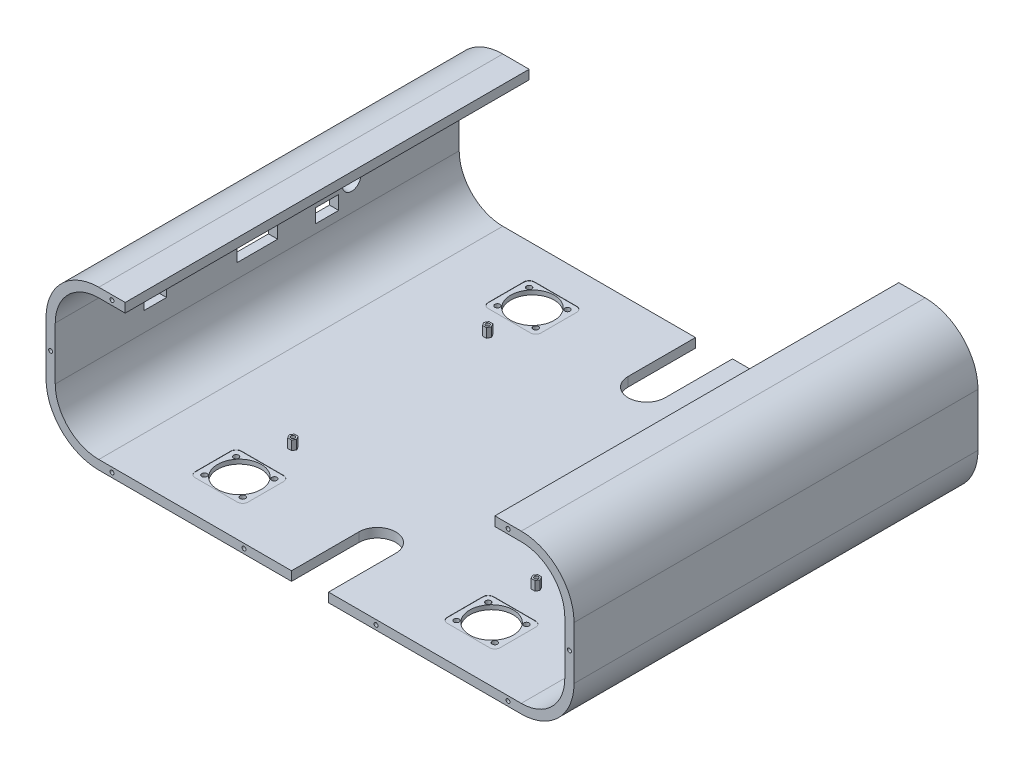
from build123d import *

# Parameters (mm, degrees)
SKETCH1_W               = 400
SKETCH1_H               = 306
BOSS_EXTRUDE1_DEPTH     = 7
BOSS_EXTRUDE3_DEPTH     = 306
CUT_EXTRUDE1_DEPTH      = 385.754467161
CUT_EXTRUDE1_DEPTH_BACK = 385.754467161
CUT_EXTRUDE2_START      = -7
SKETCH7_R               = 1.5
CUT_EXTRUDE2_DEPTH      = 392.754467161
CUT_EXTRUDE3_DEPTH      = 277.003623165
CUT_EXTRUDE3_DEPTH_BACK = 277.003623165
SKETCH8_W               = 28
SKETCH8_H               = 130
FILLET1_R               = 14
FILLET2_R               = 14
BOSS_EXTRUDE4_START     = 2
SKETCH9_R               = 1.5
BOSS_EXTRUDE4_DEPTH     = 7
BOSS_EXTRUDE4_2_DEPTH   = 7
BOSS_EXTRUDE4_3_DEPTH   = 7
BOSS_EXTRUDE4_4_DEPTH   = 7
CUT_EXTRUDE4_DEPTH      = 279.942646435
CUT_EXTRUDE4_DEPTH_BACK = 279.942646435
SKETCH10_R              = 2
SKETCH10_R_2            = 16.5
CUT_EXTRUDE5_DEPTH      = 279.942646435
CUT_EXTRUDE5_DEPTH_BACK = 3.5
SKETCH12_R              = 30
SKETCH13_W              = 40
SKETCH13_H              = 35
CUT_EXTRUDE6_DEPTH      = 0.2
FILLET3_R               = 4
SKETCH16_R              = 6.93
SKETCH16_W              = 31
SKETCH16_H              = 20
SKETCH16_W_2            = 12.2
SKETCH16_H_2            = 5.5
SKETCH16_W_3            = 17.5
SKETCH16_H_3            = 10.5
SKETCH16_W_4            = 17.3
SKETCH16_H_4            = 11.6
CUT_EXTRUDE7_DEPTH      = 10


with BuildPart() as part:
    # Sketch1 → Boss-Extrude1 (new body)
    with BuildSketch(Plane(origin=(0, 0, 0), x_dir=(1, 0, 0), z_dir=(0, 1, 0))):
        Rectangle(SKETCH1_W, SKETCH1_H)
    extrude(amount=BOSS_EXTRUDE1_DEPTH)

    # Sketch5 → Boss-Extrude3 (add)
    with BuildSketch(Plane.XY.offset(153)):
        with BuildLine():
            ThreePointArc((-200, 40), (-195.385112438, 21.348088093), (-182.605309111, 7))
            Line((-182.605309111, 7), (-160, 7))
            ThreePointArc((-160, 7), (-183.334523779, 16.665476221), (-193, 40))
            Line((-193, 40), (-193, 80))
            ThreePointArc((-193, 80), (-183.334523779, 103.334523779), (-160, 113))
            Line((-160, 113), (-140, 113))
            Line((-140, 113), (-140, 120))
            Line((-140, 120), (-160, 120))
            ThreePointArc((-160, 120), (-188.284271247, 108.284271247), (-200, 80))
            Line((-200, 80), (-200, 40))
        make_face()
        with BuildLine():
            ThreePointArc((193, 40), (183.334523779, 16.665476221), (160, 7))
            Line((160, 7), (182.605309111, 7))
            ThreePointArc((182.605309111, 7), (195.385112438, 21.348088093), (200, 40))
            Line((200, 40), (200, 80))
            ThreePointArc((200, 80), (188.284271247, 108.284271247), (160, 120))
            Line((160, 120), (140, 120))
            Line((140, 120), (140, 113))
            Line((140, 113), (160, 113))
            ThreePointArc((160, 113), (183.334523779, 103.334523779), (193, 80))
            Line((193, 80), (193, 40))
        make_face()
    extrude(amount=-BOSS_EXTRUDE3_DEPTH)

    # Sketch6 → Cut-Extrude1 (cut, two sides: drawn at the far end of the back side and taken through both)
    with BuildSketch(Plane.XY.offset(153).offset(-CUT_EXTRUDE1_DEPTH_BACK)):
        with BuildLine():
            Line((-182.605309111, 7), (-200, 7))
            Line((-200, 7), (-200, 0))
            Line((-200, 0), (-160, 0))
            ThreePointArc((-160, 0), (-171.832159566, 1.790053651), (-182.605309111, 7))
        make_face()
        with BuildLine():
            Line((200, 0), (160, 0))
            ThreePointArc((160, 0), (171.832159566, 1.790053651), (182.605309111, 7))
            Line((182.605309111, 7), (200, 7))
            Line((200, 7), (200, 0))
        make_face()
    extrude(amount=CUT_EXTRUDE1_DEPTH + CUT_EXTRUDE1_DEPTH_BACK, mode=Mode.SUBTRACT)

    # Sketch7 → Cut-Extrude2 (cut)
    with BuildSketch(Plane.XY.offset(153).offset(CUT_EXTRUDE2_START)):
        with Locations(Location((-50, 3.5, 0), (0, 0, 180))):
            Circle(SKETCH7_R)
        with Locations(Location((-150, 3.5, 0), (0, 0, 180))):
            Circle(SKETCH7_R)
        with Locations(Location((-196.5, 60, 0), (0, 0, 180))):
            Circle(SKETCH7_R)
        with Locations(Location((-150, 116.5, 0), (0, 0, 180))):
            Circle(SKETCH7_R)
        with Locations(Location((150, 116.5, 0), (0, 0, 180))):
            Circle(SKETCH7_R)
        with Locations(Location((196.5, 60, 0), (0, 0, 180))):
            Circle(SKETCH7_R)
        with Locations(Location((150, 3.5, 0), (0, 0, 180))):
            Circle(SKETCH7_R)
        with Locations(Location((50, 3.5, 0), (0, 0, 180))):
            Circle(SKETCH7_R)
    cut_extrude2 = extrude(amount=CUT_EXTRUDE2_DEPTH, mode=Mode.SUBTRACT)

    # Mirror1: Cut-Extrude2 across plane
    add(cut_extrude2.mirror(Plane.XY), mode=Mode.SUBTRACT)

    # Sketch8 → Cut-Extrude3 (cut, two sides: drawn at the far end of the back side and taken through both)
    with BuildSketch(Plane(origin=(0, 7, 0), x_dir=(1, 0, 0), z_dir=(0, 1, 0)).offset(-CUT_EXTRUDE3_DEPTH_BACK)):
        with Locations((0, -153)):
            Rectangle(SKETCH8_W, SKETCH8_H)
        with Locations((0, 153)):
            Rectangle(SKETCH8_W, SKETCH8_H)
    extrude(amount=CUT_EXTRUDE3_DEPTH + CUT_EXTRUDE3_DEPTH_BACK, mode=Mode.SUBTRACT)

    # Fillet1
    fillet1_edges = [part.edges().sort_by_distance(p)[0] for p in [
        (-14, 3.5, 88),
        (14, 3.5, 88),
    ]]
    fillet(fillet1_edges, radius=FILLET1_R - 0.0001)  # a hair under: the kernel refuses the full size

    # Fillet2
    fillet2_edges = [part.edges().sort_by_distance(p)[0] for p in [
        (14, 3.5, -88),
        (-14, 3.5, -88),
    ]]
    fillet(fillet2_edges, radius=FILLET2_R - 0.0001)  # a hair under: the kernel refuses the full size

    # Sketch10 → Cut-Extrude4 (cut, two sides: drawn at the far end of the back side and taken through both)
    with BuildSketch(Plane.XZ.offset(-CUT_EXTRUDE4_DEPTH_BACK)):
        with Locations(Location((-110, 123, 0), (0, 0, 270))):
            Circle(SKETCH10_R)
        with Locations(Location((-81, 123, 0), (0, 0, 270))):
            Circle(SKETCH10_R)
        with Locations(Location((-110, 99, 0), (0, 0, 270))):
            Circle(SKETCH10_R)
        with Locations(Location((-81, 99, 0), (0, 0, 270))):
            Circle(SKETCH10_R)
        with Locations(Location((-81, -99, 0), (0, 0, 270))):
            Circle(SKETCH10_R)
        with Locations(Location((-110, -99, 0), (0, 0, 270))):
            Circle(SKETCH10_R)
        with Locations(Location((-81, -123, 0), (0, 0, 270))):
            Circle(SKETCH10_R)
        with Locations(Location((-110, -123, 0), (0, 0, 270))):
            Circle(SKETCH10_R)
        with Locations(Location((110, -123, 0), (0, 0, 270))):
            Circle(SKETCH10_R)
        with Locations(Location((81, -123, 0), (0, 0, 270))):
            Circle(SKETCH10_R)
        with Locations(Location((110, -99, 0), (0, 0, 270))):
            Circle(SKETCH10_R)
        with Locations(Location((81, -99, 0), (0, 0, 270))):
            Circle(SKETCH10_R)
        with Locations(Location((81, 99, 0), (0, 0, 270))):
            Circle(SKETCH10_R)
        with Locations(Location((110, 99, 0), (0, 0, 270))):
            Circle(SKETCH10_R)
        with Locations(Location((81, 123, 0), (0, 0, 270))):
            Circle(SKETCH10_R)
        with Locations(Location((110, 123, 0), (0, 0, 270))):
            Circle(SKETCH10_R)
        with Locations(Location((-95.5, 111, 0), (0, 0, 270))):
            Circle(SKETCH10_R_2)
        with Locations(Location((95.5, 111, 0), (0, 0, 270))):
            Circle(SKETCH10_R_2)
        with Locations(Location((95.5, -111, 0), (0, 0, 270))):
            Circle(SKETCH10_R_2)
        with Locations(Location((-95.5, -111, 0), (0, 0, 270))):
            Circle(SKETCH10_R_2)
    extrude(amount=CUT_EXTRUDE4_DEPTH + CUT_EXTRUDE4_DEPTH_BACK, mode=Mode.SUBTRACT)

    # Sketch12 → Cut-Extrude5 (cut, two sides: drawn at the far end of the back side and taken through both)
    with BuildSketch(Plane.XZ.offset(-CUT_EXTRUDE5_DEPTH_BACK)):
        with Locations(Location((-95.5, 111, 0), (0, 0, 90))):
            Circle(SKETCH12_R)
        with Locations(Location((-95.5, -111, 0), (0, 0, 90))):
            Circle(SKETCH12_R)
        with Locations(Location((95.5, -111, 0), (0, 0, 90))):
            Circle(SKETCH12_R)
        with Locations(Location((95.5, 111, 0), (0, 0, 90))):
            Circle(SKETCH12_R)
    extrude(amount=CUT_EXTRUDE5_DEPTH + CUT_EXTRUDE5_DEPTH_BACK, mode=Mode.SUBTRACT)

    # Sketch13 → Cut-Extrude6 (cut)
    with BuildSketch(Plane(origin=(0, 7, 0), x_dir=(1, 0, 0), z_dir=(0, 1, 0))):
        with Locations((-95.5, -111)):
            Rectangle(SKETCH13_W, SKETCH13_H)
        with Locations((95.5, -111)):
            Rectangle(SKETCH13_W, SKETCH13_H)
        with Locations((95.5, 111)):
            Rectangle(SKETCH13_W, SKETCH13_H)
        with Locations((-95.5, 111)):
            Rectangle(SKETCH13_W, SKETCH13_H)
    extrude(amount=-CUT_EXTRUDE6_DEPTH, mode=Mode.SUBTRACT)

    # Fillet3
    fillet3_edges = [part.edges().sort_by_distance(p)[0] for p in [
        (-115.5, 6.9, -93.5),
        (-115.5, 6.9, -128.5),
        (-75.5, 6.9, -128.5),
        (-75.5, 6.9, -93.5),
        (115.5, 6.9, -128.5),
        (115.5, 6.9, -93.5),
        (75.5, 6.9, -93.5),
        (75.5, 6.9, -128.5),
        (115.5, 6.9, 93.5),
        (115.5, 6.9, 128.5),
        (75.5, 6.9, 128.5),
        (75.5, 6.9, 93.5),
        (-75.5, 6.9, 93.5),
        (-75.5, 6.9, 128.5),
        (-115.5, 6.9, 128.5),
        (-115.5, 6.9, 93.5),
    ]]
    fillet(fillet3_edges, radius=FILLET3_R)

    # Sketch16 → Cut-Extrude7 (cut)
    with BuildSketch(Plane.ZY.offset(200)):
        with Locations((-71.5, 61.100490196)):
            Circle(SKETCH16_R)
        with Locations((0, 60.75)):
            Rectangle(SKETCH16_W, SKETCH16_H)
        with Locations((-53, 70.259915056)):
            Rectangle(SKETCH16_W_2, SKETCH16_H_2)
        with Locations((-53, 51.759915056)):
            Rectangle(SKETCH16_W_3, SKETCH16_H_3)
        with Locations((77.294852469, 60.371103664)):
            Rectangle(SKETCH16_W_4, SKETCH16_H_4)
    extrude(amount=-CUT_EXTRUDE7_DEPTH, mode=Mode.SUBTRACT)


with BuildPart() as body_2:
    # Sketch9 → Boss-Extrude4 (new body)
    with BuildSketch(Plane(origin=(0, 7, 0), x_dir=(1, 0, 0), z_dir=(0, 1, 0)).offset(BOSS_EXTRUDE4_START)):
        Polygon((-89.30456056, 73.753049524), (-90.747936233, 76.253049524), (-93.634687579, 76.253049524), (-95.078063252, 73.753049524), (-93.634687579, 71.253049524), (-90.747936233, 71.253049524), align=None)
        with Locations(Location((-92.191311906, 73.753049524, 0), (0, 0, 270))):
            Circle(SKETCH9_R, mode=Mode.SUBTRACT)
    extrude(amount=BOSS_EXTRUDE4_DEPTH)


with BuildPart() as body_3:
    # Sketch9 → Boss-Extrude4 2 (new body)
    with BuildSketch(Plane(origin=(0, 7, 0), x_dir=(1, 0, 0), z_dir=(0, 1, 0)).offset(BOSS_EXTRUDE4_START)):
        Polygon((-90.747936233, -71.253049524), (-89.30456056, -73.753049524), (-90.747936233, -76.253049524), (-93.634687579, -76.253049524), (-95.078063252, -73.753049524), (-93.634687579, -71.253049524), align=None)
        with Locations(Location((-92.191311906, -73.753049524, 0), (0, 0, 90))):
            Circle(SKETCH9_R, mode=Mode.SUBTRACT)
    extrude(amount=BOSS_EXTRUDE4_2_DEPTH)


with BuildPart() as body_4:
    # Sketch9 → Boss-Extrude4 3 (new body)
    with BuildSketch(Plane(origin=(0, 7, 0), x_dir=(1, 0, 0), z_dir=(0, 1, 0)).offset(BOSS_EXTRUDE4_START)):
        Polygon((89.30456056, -73.753049524), (90.747936233, -76.253049524), (93.634687579, -76.253049524), (95.078063252, -73.753049524), (93.634687579, -71.253049524), (90.747936233, -71.253049524), align=None)
        with Locations(Location((92.191311906, -73.753049524, 0), (0, 0, 270))):
            Circle(SKETCH9_R, mode=Mode.SUBTRACT)
    extrude(amount=BOSS_EXTRUDE4_3_DEPTH)


with BuildPart() as body_5:
    # Sketch9 → Boss-Extrude4 4 (new body)
    with BuildSketch(Plane(origin=(0, 7, 0), x_dir=(1, 0, 0), z_dir=(0, 1, 0)).offset(BOSS_EXTRUDE4_START)):
        Polygon((90.747936233, 71.253049524), (89.30456056, 73.753049524), (90.747936233, 76.253049524), (93.634687579, 76.253049524), (95.078063252, 73.753049524), (93.634687579, 71.253049524), align=None)
        with Locations(Location((92.191311906, 73.753049524, 0), (0, 0, 90))):
            Circle(SKETCH9_R, mode=Mode.SUBTRACT)
    extrude(amount=BOSS_EXTRUDE4_4_DEPTH)


solid = Compound([part.part, body_2.part, body_3.part, body_4.part, body_5.part])
